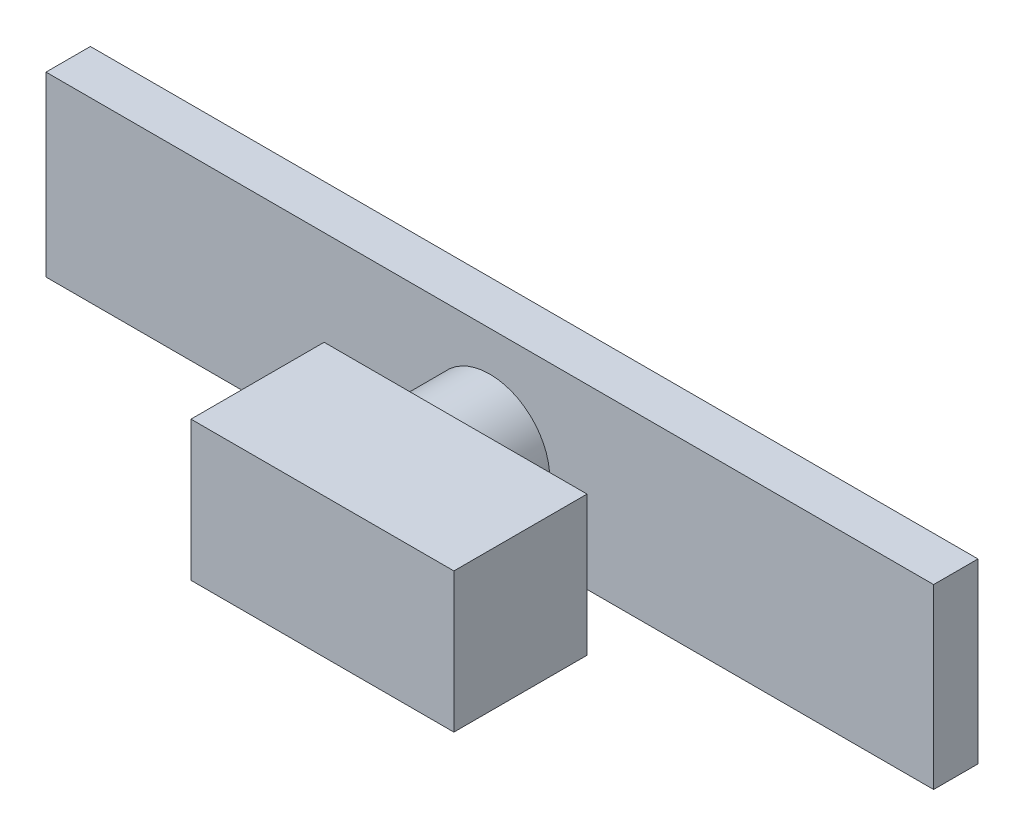
from build123d import *

# Parameters (mm, degrees)
SKETCH2_W             = 254
SKETCH2_H             = 12.7
BOSS_EXTRUDE1_DEPTH   = 50.8
SKETCH3_R             = 17.140791438
BOSS_EXTRUDE2_DEPTH   = 19.05
SKETCH4_W             = 75.235944222
SKETCH4_H             = 39.955088207
BOSS_EXTRUDE3_DEPTH   = 38.1
SCALE2_SCALE          = 0.06
BODY_MOVE_COPY1_ANGLE = 90
SCALE5_SCALE          = 0.25


with BuildPart() as part:
    # Sketch2 → Boss-Extrude1 (new body)
    with BuildSketch(Plane.XY):
        with Locations((79.130769231, 14.898076923)):
            Rectangle(SKETCH2_W, SKETCH2_H)
    extrude(amount=BOSS_EXTRUDE1_DEPTH)

    # Sketch3 → Boss-Extrude2 (add)
    with BuildSketch(Plane(origin=(0, 21.248076923, 0), x_dir=(1, 0, 0), z_dir=(0, 1, 0))):
        with Locations((79.130769231, -28.483063876)):
            Circle(SKETCH3_R)
    extrude(amount=BOSS_EXTRUDE2_DEPTH)

    # Sketch4 → Boss-Extrude3 (add)
    with BuildSketch(Plane(origin=(0, 40.298076923, 0), x_dir=(1, 0, 0), z_dir=(0, 1, 0))):
        with Locations((88.38546847, -28.088530296)):
            Rectangle(SKETCH4_W, SKETCH4_H)
    extrude(amount=BOSS_EXTRUDE3_DEPTH)


with BuildPart() as part_1:
    # Scale2: scaled about (82.711857342, 33.041003565, 26.623476887)
    add(part.part.scale(SCALE2_SCALE).moved(Location((77.749145901, 31.058543351, 25.026068274))))


with BuildPart() as part_2:
    # Body-Move/Copy1: moved
    add(part_1.part.rotate(Axis((0, 33.666927966, 26.550068274), (1, 0, 0)), BODY_MOVE_COPY1_ANGLE))


with BuildPart() as part_3:
    # Body-Move/Copy3: moved
    add(part_2.part.moved(Location((-50.8, 0, -50.8))))


with BuildPart() as part_4:
    # Scale5: scaled about (31.911857342, 33.593519353, -24.875856127)
    add(part_3.part.scale(SCALE5_SCALE).moved(Location((23.933893006, 25.195139515, -18.656892095))))


with BuildPart() as part_5:
    # Body-Move/Copy5: moved
    add(part_4.part.moved(Location((50.8, 0, 0))))


solid = part_5.part
